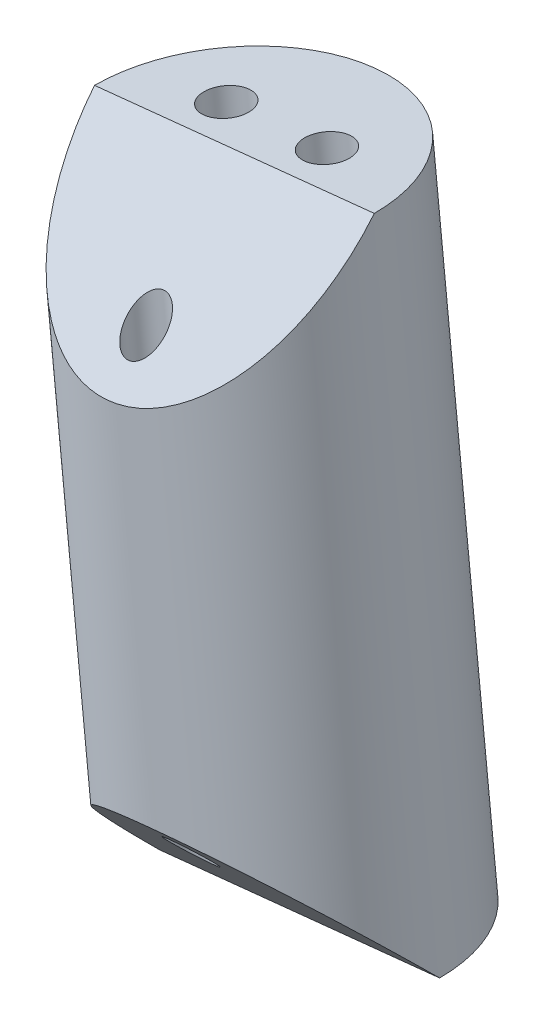
from build123d import *

# Parameters (mm, degrees)
SKETCH3_R               = 10
BOSS_EXTRUDE1_DEPTH     = 45
CUT_EXTRUDE1_DEPTH      = 200.773506304
CUT_EXTRUDE1_DEPTH_BACK = 200.773506304
CUT_EXTRUDE3_DEPTH      = 53.179337163
CUT_EXTRUDE3_DEPTH_BACK = 53.179337163
SKETCH8_R               = 1.6
SKETCH8_R_2             = 1.4


with BuildPart() as part:
    # Sketch3 → Boss-Extrude1 (new body)
    with BuildSketch(Plane(origin=(-20.344467381, 196.178792599, 0), x_dir=(-0.9946657577296572, -0.10315052302381678, 0), z_dir=(0.10315052302381678, -0.9946657577296572, 0))):
        with Locations((-10.431405186, 0)):
            Circle(SKETCH3_R)
    extrude(amount=BOSS_EXTRUDE1_DEPTH)

    # Sketch4 → Cut-Extrude1 (cut, two sides: drawn at the far end of the back side and taken through both)
    with BuildSketch(Plane(origin=(10.375761543, 1.076004901, 0), x_dir=(0.10315052302381672, -0.9946657577296572, 0), z_dir=(-0.9946657577296572, -0.10315052302381673, 0)).offset(-CUT_EXTRUDE1_DEPTH_BACK)):
        Polygon((-197.230869842, 0), (-187.230869842, 10), (-197.230869842, 10), align=None)
        Polygon((-162.230869842, 10), (-152.230869842, 10), (-152.230869842, 0), align=None)
    extrude(amount=CUT_EXTRUDE1_DEPTH + CUT_EXTRUDE1_DEPTH_BACK, mode=Mode.SUBTRACT)

    # Sketch8 → Cut-Extrude3 (cut, two sides: drawn at the far end of the back side and taken through both)
    with BuildSketch(Plane(origin=(-20.344467381, 196.178792599, 0), x_dir=(0.9946657577296572, 0.10315052302381678, 0), z_dir=(-0.10315052302381678, 0.9946657577296572, 0)).offset(-CUT_EXTRUDE3_DEPTH_BACK)):
        with Locations((6.831405186, 3)):
            Circle(SKETCH8_R)
        with Locations((14.031405186, 3)):
            Circle(SKETCH8_R)
        with Locations((10.431405186, -7)):
            Circle(SKETCH8_R_2)
    extrude(amount=CUT_EXTRUDE3_DEPTH + CUT_EXTRUDE3_DEPTH_BACK, mode=Mode.SUBTRACT)


solid = part.part
